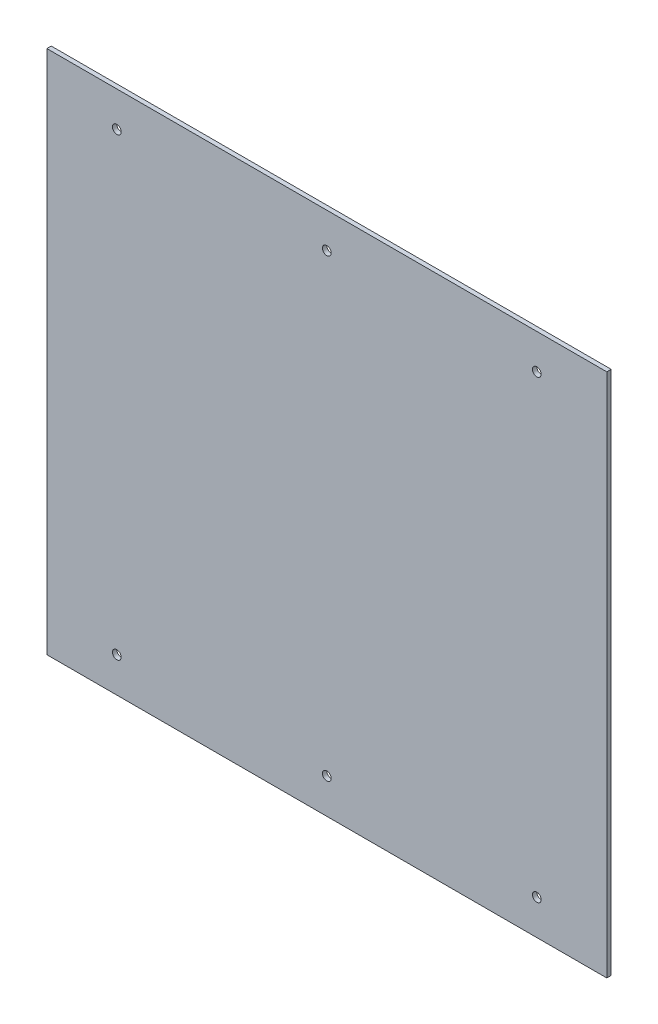
from build123d import *

# Parameters (mm, degrees)
SKETCH_1_W      = 203.2
SKETCH_1_H      = 190.5
SKETCH_1_R      = 1.5875
EXTRUDE_2_DEPTH = 1.5875


with BuildPart() as part:
    # 스케치1 → 보스-돌출2 (new body)
    with BuildSketch(Plane.XY):
        with Locations((0, -6.35)):
            Rectangle(SKETCH_1_W, SKETCH_1_H)
        with Locations((76.2, -88.9)):
            Circle(SKETCH_1_R, mode=Mode.SUBTRACT)
        with Locations((0, -88.9)):
            Circle(SKETCH_1_R, mode=Mode.SUBTRACT)
        with Locations((-76.2, -88.9)):
            Circle(SKETCH_1_R, mode=Mode.SUBTRACT)
        with Locations((-76.2, 76.2)):
            Circle(SKETCH_1_R, mode=Mode.SUBTRACT)
        with Locations((0, 76.2)):
            Circle(SKETCH_1_R, mode=Mode.SUBTRACT)
        with Locations((76.2, 76.2)):
            Circle(SKETCH_1_R, mode=Mode.SUBTRACT)
    extrude(amount=EXTRUDE_2_DEPTH)


solid = part.part
